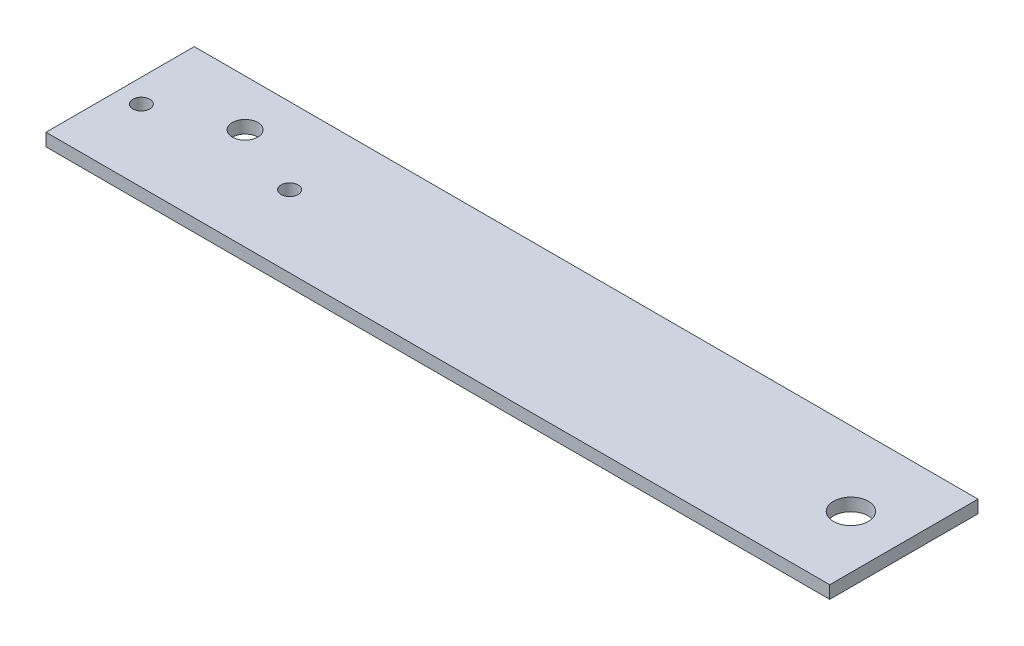
from build123d import *

# Parameters (mm, degrees)
SKETCH1_W           = 185
SKETCH1_H           = 35
SKETCH1_R           = 4.125
BOSS_EXTRUDE1_DEPTH = 3
SKETCH2_R           = 3
SKETCH2_R_2         = 2
CUT_EXTRUDE1_DEPTH  = 95.188640504


with BuildPart() as part:
    # Sketch1 → Boss-Extrude1 (new body)
    with BuildSketch(Plane(origin=(0, 0, 0), x_dir=(1, 0, 0), z_dir=(0, 1, 0))):
        Rectangle(SKETCH1_W, SKETCH1_H)
        with Locations((80, 0)):
            Circle(SKETCH1_R, mode=Mode.SUBTRACT)
    extrude(amount=BOSS_EXTRUDE1_DEPTH)

    # Sketch2 → Cut-Extrude1 (cut, through all)
    with BuildSketch(Plane(origin=(0, 3, 0), x_dir=(1, 0, 0), z_dir=(0, 1, 0))):
        with Locations((-69.5, 6.5)):
            Circle(SKETCH2_R)
        with Locations((-87, -0.5)):
            Circle(SKETCH2_R_2)
        with Locations((-52, -0.5)):
            Circle(SKETCH2_R_2)
    extrude(amount=-CUT_EXTRUDE1_DEPTH, mode=Mode.SUBTRACT)


solid = part.part
